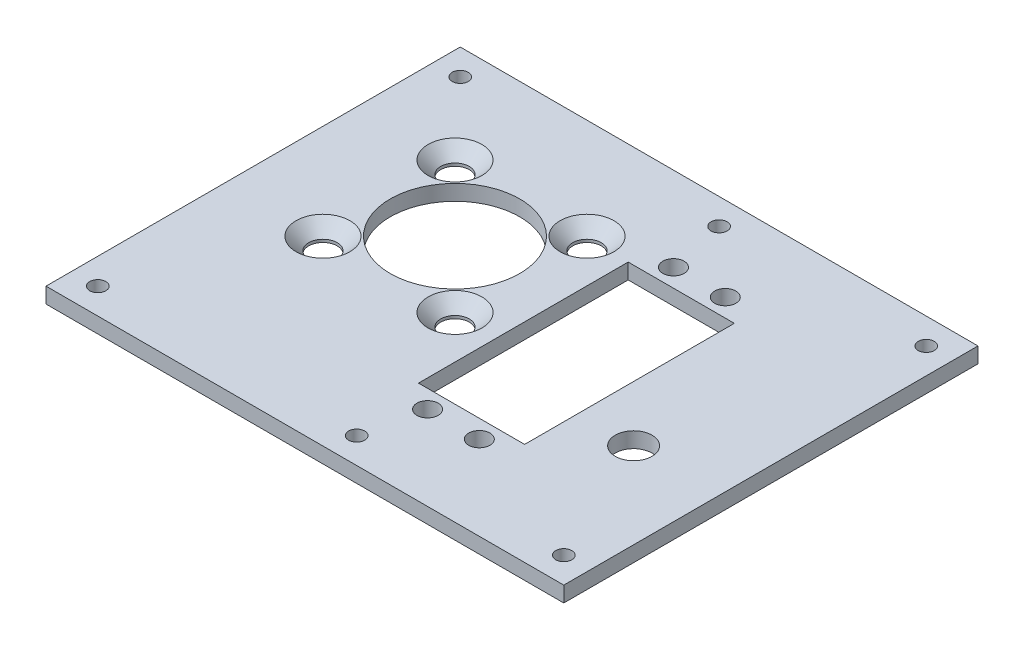
from build123d import *

# Parameters (mm, degrees)
SZKIC1_W                                     = 100
SZKIC1_H                                     = 80
SZKIC1_R                                     = 1.55
SZKIC1_R_2                                   = 2.55
SZKIC1_R_3                                   = 2.05
SZKIC1_R_4                                   = 3.55
SZKIC1_R_5                                   = 12.5
SZKIC1_W_2                                   = 20.5
SZKIC1_H_2                                   = 40.5
DODANIE_WYCI_GNI_CIE1_DEPTH                  = 3
CSK_FOR_M5_COUNTERSUNK_FLAT_HEAD_SCR_2_COUNT = 2
CSK_FOR_M5_COUNTERSUNK_FLAT_HEAD_SCR_2_PITCH = 25.5
CSK_FOR_M5_COUNTERSUNK_FLAT_HEAD_SCR_3_COUNT = 2
CSK_FOR_M5_COUNTERSUNK_FLAT_HEAD_SCR_3_PITCH = 36.062445841
CSK_FOR_M5_COUNTERSUNK_FLAT_HEAD_SCR_4_COUNT = 2
CSK_FOR_M5_COUNTERSUNK_FLAT_HEAD_SCR_4_PITCH = 25.5


with BuildPart() as part:
    # Szkic1 → Dodanie-wyciągnięcie1 (new body)
    with BuildSketch(Plane(origin=(0, 0, 0), x_dir=(1, 0, 0), z_dir=(0, 1, 0))):
        with Locations((11.336719097, -8.838965942)):
            Rectangle(SZKIC1_W, SZKIC1_H)
        with Locations((-33.663280903, -43.838965942)):
            Circle(SZKIC1_R, mode=Mode.SUBTRACT)
        with Locations((-20.268770099, -13.743104788)):
            Circle(SZKIC1_R_2, mode=Mode.SUBTRACT)
        with Locations((5.231229901, -13.743104788)):
            Circle(SZKIC1_R_2, mode=Mode.SUBTRACT)
        with Locations((16.336719097, -43.838965942)):
            Circle(SZKIC1_R, mode=Mode.SUBTRACT)
        with Locations((18.775116298, -32.588965942)):
            Circle(SZKIC1_R_3, mode=Mode.SUBTRACT)
        with Locations((28.775116298, -32.588965942)):
            Circle(SZKIC1_R_3, mode=Mode.SUBTRACT)
        with Locations((56.336719097, -43.838965942)):
            Circle(SZKIC1_R, mode=Mode.SUBTRACT)
        with Locations((44.775116298, -18.788965942)):
            Circle(SZKIC1_R_4, mode=Mode.SUBTRACT)
        with Locations((-7.518770099, -0.993104788)):
            Circle(SZKIC1_R_5, mode=Mode.SUBTRACT)
        with Locations((-20.268770099, 11.756895212)):
            Circle(SZKIC1_R_2, mode=Mode.SUBTRACT)
        with Locations((-33.663280903, 26.161034058)):
            Circle(SZKIC1_R, mode=Mode.SUBTRACT)
        with Locations((5.231229901, 11.756895212)):
            Circle(SZKIC1_R_2, mode=Mode.SUBTRACT)
        with Locations((23.775116298, -8.838965942)):
            Rectangle(SZKIC1_W_2, SZKIC1_H_2, mode=Mode.SUBTRACT)
        with Locations((18.775116298, 14.911034058)):
            Circle(SZKIC1_R_3, mode=Mode.SUBTRACT)
        with Locations((28.775116298, 14.911034058)):
            Circle(SZKIC1_R_3, mode=Mode.SUBTRACT)
        with Locations((16.336719097, 26.161034058)):
            Circle(SZKIC1_R, mode=Mode.SUBTRACT)
        with Locations((56.336719097, 26.161034058)):
            Circle(SZKIC1_R, mode=Mode.SUBTRACT)
    extrude(amount=DODANIE_WYCI_GNI_CIE1_DEPTH)

    # Sketch4 → CSK for M5 Countersunk Flat Head Screw2 (revolve, cut)
    with BuildSketch(Plane(origin=(-20.268770099, 3, 13.743104788), x_dir=(0, 0, 1), z_dir=(1, 0, 0))):
        Polygon((0, 0), (0, 3), (2.75, 3), (2.75, 2.45), (5.2, 0), align=None)
    csk_for_m5_countersunk_flat_head_screw2 = revolve(axis=Axis((-20.268770099, 9.35, 13.743104788), (0, -1, 0)), mode=Mode.SUBTRACT)

    # CSK for M5 Countersunk Flat Head Scr 2: CSK for M5 Countersunk Flat Head Screw2 ×2
    with Locations(*[(i * CSK_FOR_M5_COUNTERSUNK_FLAT_HEAD_SCR_2_PITCH, 0, 0) for i in range(1, CSK_FOR_M5_COUNTERSUNK_FLAT_HEAD_SCR_2_COUNT)]):
        add(csk_for_m5_countersunk_flat_head_screw2, mode=Mode.SUBTRACT)

    # CSK for M5 Countersunk Flat Head Scr 3: CSK for M5 Countersunk Flat Head Screw2 ×2
    with Locations(*[Vector(0.7071067811865475, 0, -0.7071067811865476) * (i * CSK_FOR_M5_COUNTERSUNK_FLAT_HEAD_SCR_3_PITCH) for i in range(1, CSK_FOR_M5_COUNTERSUNK_FLAT_HEAD_SCR_3_COUNT)]):
        add(csk_for_m5_countersunk_flat_head_screw2, mode=Mode.SUBTRACT)

    # CSK for M5 Countersunk Flat Head Scr 4: CSK for M5 Countersunk Flat Head Screw2 ×2
    with Locations(*[(0, 0, -i * CSK_FOR_M5_COUNTERSUNK_FLAT_HEAD_SCR_4_PITCH) for i in range(1, CSK_FOR_M5_COUNTERSUNK_FLAT_HEAD_SCR_4_COUNT)]):
        add(csk_for_m5_countersunk_flat_head_screw2, mode=Mode.SUBTRACT)


solid = part.part
